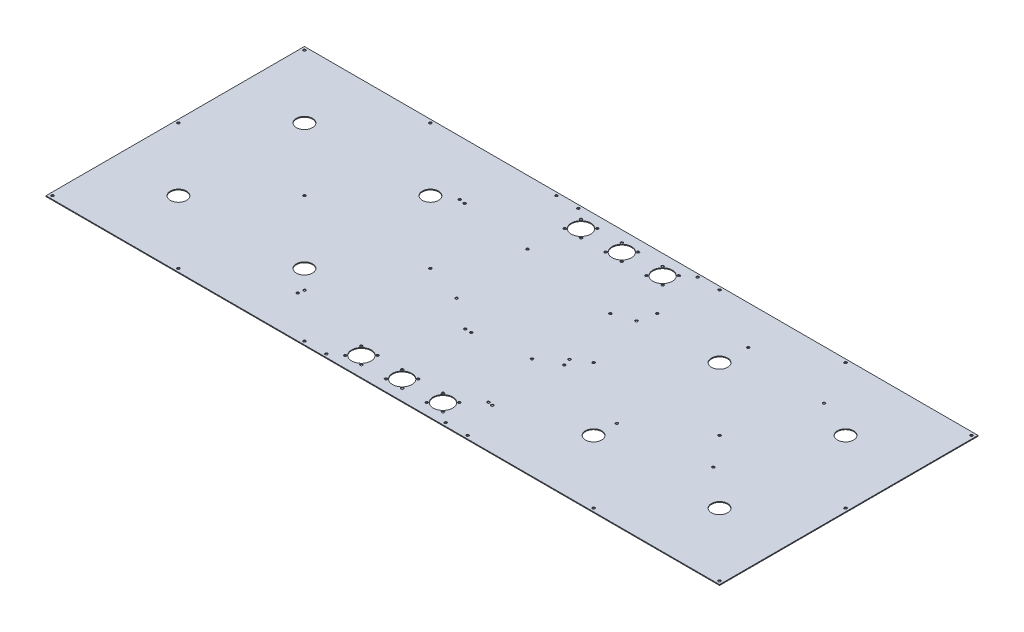
from build123d import *

# Parameters (mm, degrees)
MAIN_PLATE_W        = 834
MAIN_PLATE_H        = 320
BOSS_EXTRUDE1_DEPTH = 1.016
MAIN_HOLES_R        = 1.6
CUT_EXTRUDE1_DEPTH  = 447.64307031
SMA_R               = 10
CUT_EXTRUDE2_DEPTH  = 447.64307031
ADS9_EVAL_2_R       = 1.6
FULL_HOLES_DEPTH    = 448.008036295
FAN_R               = 1.6
FAN_R_2             = 12
CUT_EXTRUDE4_DEPTH  = 448.375011908


with BuildPart() as part:
    # main_plate → Boss-Extrude1 (new body)
    with BuildSketch(Plane(origin=(0, 0, 0), x_dir=(1, 0, 0), z_dir=(0, 1, 0))):
        Rectangle(MAIN_PLATE_W, MAIN_PLATE_H)
    extrude(amount=BOSS_EXTRUDE1_DEPTH)

    # main_holes → Cut-Extrude1 (cut, through all)
    with BuildSketch(Plane(origin=(0, 1.016, 0), x_dir=(1, 0, 0), z_dir=(0, 1, 0))):
        with Locations((-413, 156)):
            Circle(MAIN_HOLES_R)
        with Locations((-257, 156)):
            Circle(MAIN_HOLES_R)
        with Locations((-101, 156)):
            Circle(MAIN_HOLES_R)
        with Locations((-257, 0)):
            Circle(MAIN_HOLES_R)
        with Locations((-101, 0)):
            Circle(MAIN_HOLES_R)
        with Locations((-257, -156)):
            Circle(MAIN_HOLES_R)
        with Locations((-101, -156)):
            Circle(MAIN_HOLES_R)
        with Locations((-413, 0)):
            Circle(MAIN_HOLES_R)
        with Locations((-413, -156)):
            Circle(MAIN_HOLES_R)
        with Locations((413, -156)):
            Circle(MAIN_HOLES_R)
        with Locations((413, 0)):
            Circle(MAIN_HOLES_R)
        with Locations((101, -156)):
            Circle(MAIN_HOLES_R)
        with Locations((257, -156)):
            Circle(MAIN_HOLES_R)
        with Locations((101, 0)):
            Circle(MAIN_HOLES_R)
        with Locations((257, 0)):
            Circle(MAIN_HOLES_R)
        with Locations((101, 156)):
            Circle(MAIN_HOLES_R)
        with Locations((257, 156)):
            Circle(MAIN_HOLES_R)
        with Locations((413, 156)):
            Circle(MAIN_HOLES_R)
        with Locations((-73.81875, 156)):
            Circle(MAIN_HOLES_R)
        with Locations((73.81875, 156)):
            Circle(MAIN_HOLES_R)
        with Locations((73.81875, -156)):
            Circle(MAIN_HOLES_R)
        with Locations((-73.81875, -156)):
            Circle(MAIN_HOLES_R)
    extrude(amount=-CUT_EXTRUDE1_DEPTH, mode=Mode.SUBTRACT)

    # sma → Cut-Extrude2 (cut, through all)
    with BuildSketch(Plane(origin=(0, 1.016, 0), x_dir=(1, 0, 0), z_dir=(0, 1, 0))):
        with Locations((-335, 78)):
            Circle(SMA_R)
        with Locations((-179, 78)):
            Circle(SMA_R)
        with Locations((-179, -78)):
            Circle(SMA_R)
        with Locations((-335, -78)):
            Circle(SMA_R)
        with Locations((335, 78)):
            Circle(SMA_R)
        with Locations((179, 78)):
            Circle(SMA_R)
        with Locations((335, -78)):
            Circle(SMA_R)
        with Locations((179, -78)):
            Circle(SMA_R)
    extrude(amount=-CUT_EXTRUDE2_DEPTH, mode=Mode.SUBTRACT)

    # ads9_eval_2 → full_holes (cut, through all)
    with BuildSketch(Plane(origin=(0, 1.016, 1.016), x_dir=(1, 0, 0), z_dir=(0, 1, 0))):
        with Locations((180.624415858, 112.936757464)):
            Circle(ADS9_EVAL_2_R)
        with Locations((287.304415858, 100.179523877)):
            Circle(ADS9_EVAL_2_R)
        with Locations((287.230832177, -36.980456385)):
            Circle(ADS9_EVAL_2_R)
        with Locations((180.53720557, -49.623219142)):
            Circle(ADS9_EVAL_2_R)
        with Locations((-156.795231329, 93.209451678)):
            Circle(ADS9_EVAL_2_R)
        with Locations((-149.555231329, 91.889451678)):
            Circle(ADS9_EVAL_2_R)
        with Locations((-155.535231329, -100.270548322)):
            Circle(ADS9_EVAL_2_R)
        with Locations((-156.805231329, -107.450548322)):
            Circle(ADS9_EVAL_2_R)
        with Locations((-14.565231329, -42.360548322)):
            Circle(ADS9_EVAL_2_R)
        with Locations((-6.945231329, -42.360548322)):
            Circle(ADS9_EVAL_2_R)
        with Locations((58.914768671, -33.110548322)):
            Circle(ADS9_EVAL_2_R)
        with Locations((-52.845231329, -14.730548322)):
            Circle(ADS9_EVAL_2_R)
        with Locations((85.304768671, -19.820548322)):
            Circle(ADS9_EVAL_2_R)
        with Locations((82.594768671, -10.350548322)):
            Circle(ADS9_EVAL_2_R)
        with Locations((78.394768671, -106.490548322)):
            Circle(ADS9_EVAL_2_R)
        with Locations((84.03720557, -107.450548322)):
            Circle(ADS9_EVAL_2_R)
        with Locations((58.924768671, 63.919451678)):
            Circle(ADS9_EVAL_2_R)
        with Locations((82.754768671, 72.449451678)):
            Circle(ADS9_EVAL_2_R)
        with Locations((87.674768671, 93.209451678)):
            Circle(ADS9_EVAL_2_R)
        with Locations((-61.545231329, 81.819451678)):
            Circle(ADS9_EVAL_2_R)
    extrude(amount=-FULL_HOLES_DEPTH, mode=Mode.SUBTRACT)

    # fan → Cut-Extrude4 (cut, through all)
    with BuildSketch(Plane(origin=(0, 1.016, -2.032), x_dir=(1, 0, 0), z_dir=(0, -1, 0))):
        with Locations((-10, -123.968)):
            Circle(FAN_R)
        with Locations((10, -123.968)):
            Circle(FAN_R)
        with Locations((10, -143.968)):
            Circle(FAN_R)
        with Locations((-10, -143.968)):
            Circle(FAN_R)
        with Locations((0, -133.968)):
            Circle(FAN_R_2)
        with Locations((-60.5, -123.968)):
            Circle(FAN_R)
        with Locations((-40.5, -123.968)):
            Circle(FAN_R)
        with Locations((-40.5, -143.968)):
            Circle(FAN_R)
        with Locations((-60.5, -143.968)):
            Circle(FAN_R)
        with Locations((-50.5, -133.968)):
            Circle(FAN_R_2)
        with Locations((40.5, -123.968)):
            Circle(FAN_R)
        with Locations((60.5, -123.968)):
            Circle(FAN_R)
        with Locations((60.5, -143.968)):
            Circle(FAN_R)
        with Locations((40.5, -143.968)):
            Circle(FAN_R)
        with Locations((50.5, -133.968)):
            Circle(FAN_R_2)
        with Locations((-10, 148.032)):
            Circle(FAN_R)
        with Locations((10, 148.032)):
            Circle(FAN_R)
        with Locations((10, 128.032)):
            Circle(FAN_R)
        with Locations((-10, 128.032)):
            Circle(FAN_R)
        with Locations((0, 138.032)):
            Circle(FAN_R_2)
        with Locations((-60.5, 148.032)):
            Circle(FAN_R)
        with Locations((-40.5, 148.032)):
            Circle(FAN_R)
        with Locations((-40.5, 128.032)):
            Circle(FAN_R)
        with Locations((-60.5, 128.032)):
            Circle(FAN_R)
        with Locations((-50.5, 138.032)):
            Circle(FAN_R_2)
        with Locations((40.5, 148.032)):
            Circle(FAN_R)
        with Locations((60.5, 148.032)):
            Circle(FAN_R)
        with Locations((60.5, 128.032)):
            Circle(FAN_R)
        with Locations((40.5, 128.032)):
            Circle(FAN_R)
        with Locations((50.5, 138.032)):
            Circle(FAN_R_2)
    extrude(amount=CUT_EXTRUDE4_DEPTH, mode=Mode.SUBTRACT)


solid = part.part
